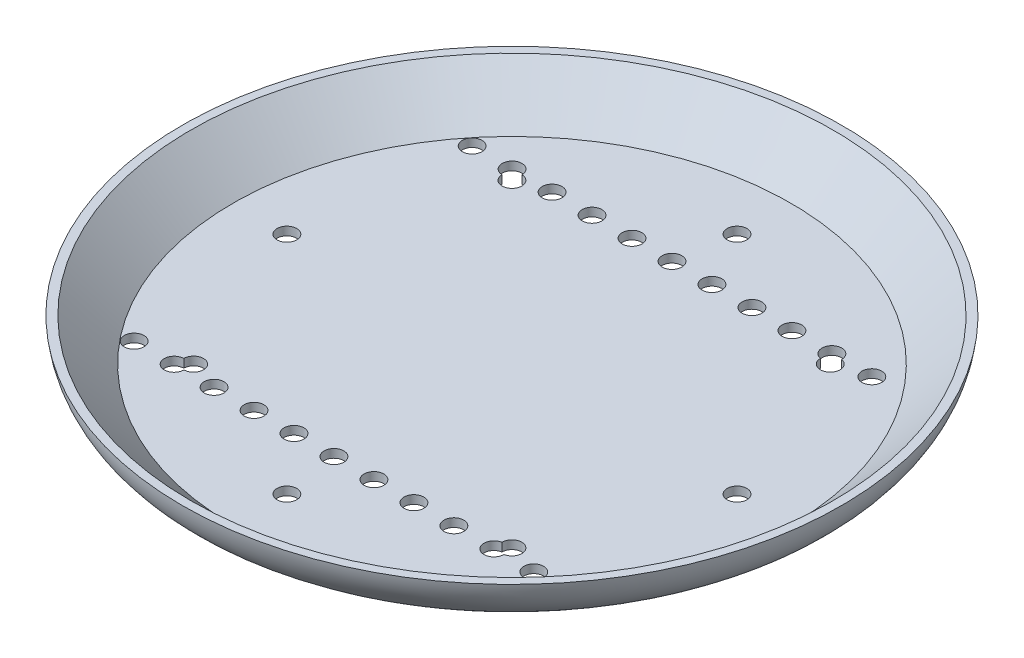
from build123d import *

# Parameters (mm, degrees)
SKETCH1_R           = 58.5
BOSS_EXTRUDE1_DEPTH = 9
SKETCH2_R           = 48.5
CUT_EXTRUDE1_DEPTH  = 7.5
CHAMFER1_SIZE       = 8.5
SKETCH3_R           = 1.75
CUT_EXTRUDE2_DEPTH  = 90
FILLET1_R           = 10
SKETCH5_R           = 1.75
CUT_EXTRUDE3_DEPTH  = 84.070753126


with BuildPart() as part:
    # Sketch1 → Boss-Extrude1 (new body)
    with BuildSketch(Plane(origin=(0, 0, 0), x_dir=(1, 0, 0), z_dir=(0, 1, 0))):
        with Locations(Location((0, 0, 0), (0, 0, 270))):
            Circle(SKETCH1_R)
    extrude(amount=BOSS_EXTRUDE1_DEPTH)

    # Sketch2 → Cut-Extrude1 (cut)
    with BuildSketch(Plane(origin=(0, 9, 0), x_dir=(1, 0, 0), z_dir=(0, 1, 0))):
        with Locations(Location((0, 0, 0), (0, 0, 270))):
            Circle(SKETCH2_R)
    extrude(amount=-CUT_EXTRUDE1_DEPTH, mode=Mode.SUBTRACT)

    # Chamfer1
    # the kernel refuses this chamfer: 8.5 mm, written as the material it takes off along each edge
    with BuildSketch(Plane(origin=(0, 9, 0), x_dir=(0, 0, 1), z_dir=(-1, 0, 0))) as chamfer1_piece_1_section:
        Polygon((48.5 + CHAMFER1_SIZE, 0), (48.5, -CHAMFER1_SIZE), (48.5, 0), align=None)
    chamfer1_piece_1 = revolve(axis=Axis((0, 9, 0), (0, 1, 0)), mode=Mode.PRIVATE)
    chamfer1_piece_1 = split(chamfer1_piece_1, bisect_by=Plane(origin=(0, 1.5, -53.205957161), z_dir=(0, 1, 0)), keep=Keep.TOP, mode=Mode.PRIVATE)
    add(chamfer1_piece_1, mode=Mode.SUBTRACT)

    # Sketch3 → Cut-Extrude2 (cut)
    with BuildSketch(Plane(origin=(0, 1.5, 0), x_dir=(1, 0, 0), z_dir=(0, 1, 0))):
        with Locations(Location((-8.68580243, 30, 0), (0, 0, 270))):
            Circle(SKETCH3_R)
        with Locations(Location((-37.06580243, 30, 0), (0, 0, 270))):
            Circle(SKETCH3_R)
        with Locations(Location((-29.97080243, 30, 0), (0, 0, 270))):
            Circle(SKETCH3_R)
        with Locations(Location((-22.87580243, 30, 0), (0, 0, 270))):
            Circle(SKETCH3_R)
        with Locations(Location((-15.78080243, 30, 0), (0, 0, 270))):
            Circle(SKETCH3_R)
        with Locations(Location((-1.59080243, 30, 0), (0, 0, 270))):
            Circle(SKETCH3_R)
        with Locations(Location((5.50419757, 30, 0), (0, 0, 270))):
            Circle(SKETCH3_R)
        with Locations(Location((12.59919757, 30, 0), (0, 0, 270))):
            Circle(SKETCH3_R)
        with Locations(Location((19.69419757, 30, 0), (0, 0, 270))):
            Circle(SKETCH3_R)
        with Locations(Location((26.78919757, 30, 0), (0, 0, 270))):
            Circle(SKETCH3_R)
        with Locations(Location((33.88419757, 30, 0), (0, 0, 270))):
            Circle(SKETCH3_R)
        with Locations(Location((33.88419757, -30, 0), (0, 0, 270))):
            Circle(SKETCH3_R)
        with Locations(Location((26.78919757, -30, 0), (0, 0, 270))):
            Circle(SKETCH3_R)
        with Locations(Location((19.69419757, -30, 0), (0, 0, 270))):
            Circle(SKETCH3_R)
        with Locations(Location((12.59919757, -30, 0), (0, 0, 270))):
            Circle(SKETCH3_R)
        with Locations(Location((5.50419757, -30, 0), (0, 0, 270))):
            Circle(SKETCH3_R)
        with Locations(Location((-1.59080243, -30, 0), (0, 0, 270))):
            Circle(SKETCH3_R)
        with Locations(Location((-15.78080243, -30, 0), (0, 0, 270))):
            Circle(SKETCH3_R)
        with Locations(Location((-22.87580243, -30, 0), (0, 0, 270))):
            Circle(SKETCH3_R)
        with Locations(Location((-29.97080243, -30, 0), (0, 0, 270))):
            Circle(SKETCH3_R)
        with Locations(Location((-37.06580243, -30, 0), (0, 0, 270))):
            Circle(SKETCH3_R)
        with Locations(Location((-8.68580243, -30, 0), (0, 0, 270))):
            Circle(SKETCH3_R)
    extrude(amount=-CUT_EXTRUDE2_DEPTH, mode=Mode.SUBTRACT)

    # Fillet1
    # the kernel refuses this fillet: 10 mm, written as the material it takes off along each edge
    with BuildSketch(Plane(origin=(0, 0, 0), x_dir=(0, 0, 1), z_dir=(-1, 0, 0))) as fillet1_piece_1:
        with BuildLine():
            CenterArc((48.550125629, 10), FILLET1_R, 270, 84.260829523)
            Line((48.550125629, 0), (48.550125629, -0.2))
            Line((48.550125629, -0.2), (58.5, -0.2))
            Line((58.5, -0.2), (58.7, 0))
            ThreePointArc((58.7, 0), (58.7, 4.5), (58.698997487, 8.98))
            Line((58.698997487, 8.98), (58.5, 9))
        make_face()
    revolve(axis=Axis((0, 0, 0), (0, 1, 0)), mode=Mode.SUBTRACT)

    # Sketch5 → Cut-Extrude3 (cut, through all)
    with BuildSketch(Plane(origin=(0, 1.5, 0), x_dir=(1, 0, 0), z_dir=(0, 1, 0))):
        with Locations(Location((0, 39.95, 0), (0, 0, 270))):
            Circle(SKETCH5_R)
        with Locations((28.248915908, 28.248915908)):
            Circle(SKETCH5_R)
        with Locations(Location((39.95, 0, 0), (0, 0, 270))):
            Circle(SKETCH5_R)
        with Locations((28.248915908, -28.248915908)):
            Circle(SKETCH5_R)
        with Locations(Location((0, -39.95, 0), (0, 0, 270))):
            Circle(SKETCH5_R)
        with Locations((-28.248915908, -28.248915908)):
            Circle(SKETCH5_R)
        with Locations(Location((-39.95, 0, 0), (0, 0, 270))):
            Circle(SKETCH5_R)
        with Locations((-28.248915908, 28.248915908)):
            Circle(SKETCH5_R)
    extrude(amount=-CUT_EXTRUDE3_DEPTH, mode=Mode.SUBTRACT)


solid = part.part
